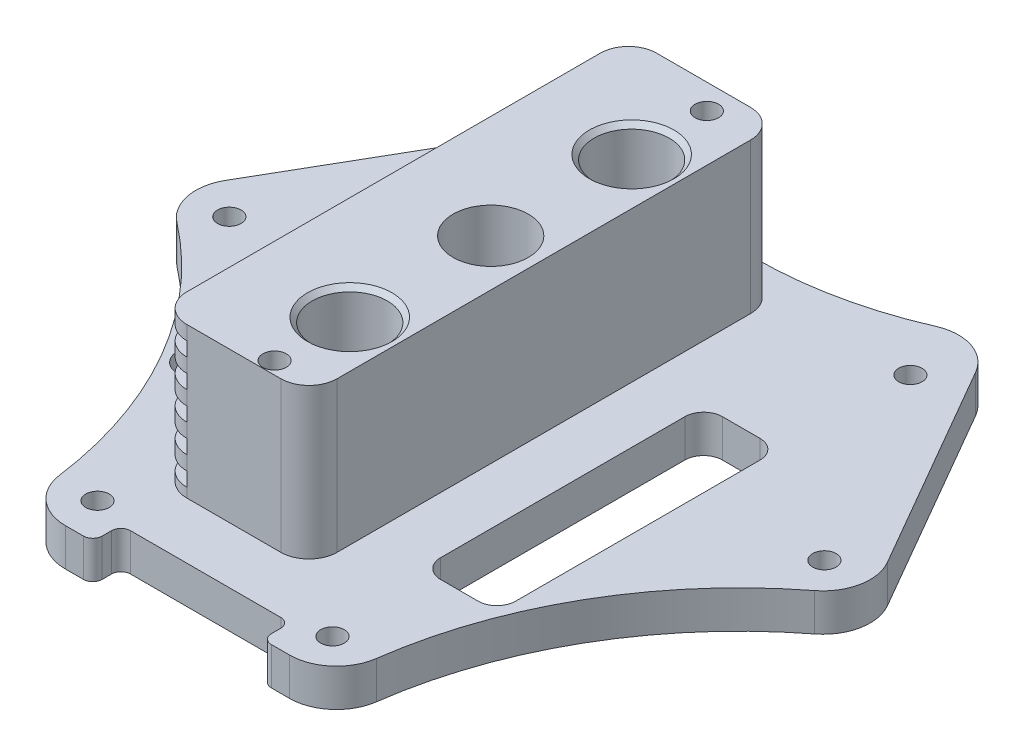
from build123d import *

# Parameters (mm, degrees)
EXTRUDE_1_DEPTH           = 4
FILLET_1_R                = 5
SKETCH_2_W                = 16
SKETCH_2_H                = 50
EXTRUDE_2_DEPTH           = 16
FILLET_2_R                = 3
SKETCH_3_W                = 6.925100322
SKETCH_3_H                = 1.5
CUT_EXTRUDE_1_DEPTH       = 70.527213361
SKETCH_4_W                = 8
SKETCH_4_H                = 30
CUT_EXTRUDE_2_DEPTH       = 52.527238457
FILLET_3_R                = 2
SKETCH_5_R                = 4
CUT_EXTRUDE_3_DEPTH       = 53.906108371
SKETCH_6_W                = 6
SKETCH_6_H                = 21
CUT_EXTRUDE_4_DEPTH       = 52.527238457
FILLET_4_R                = 2
SKETCH_7_R                = 4
CUT_EXTRUDE_5_DEPTH       = 53.906108371
CHAMFER_1_SIZE            = 0.5
M10X1_0_1_D               = 9
M10X1_0_1_DEPTH           = 4
M10X1_0_1_TIP             = 2.703872786
SKETCH_10_R               = 1
CUT_EXTRUDE_6_DEPTH       = 53.906108371
HOLE_WIZARD_M3_1_D        = 2.5
CUT_EXTRUDE_7_DEPTH       = 52.527238457
FILLET_5_R                = 3
SKETCH_17_W               = 18
SKETCH_17_H               = 3
CUT_EXTRUDE_10_DEPTH      = 4
SKETCH_18_R               = 1
CUT_EXTRUDE_11_DEPTH      = 52.527238457
HOLE_WIZARD_M3_3_D        = 2.5
PATTERN_CIRCULAR_14_COUNT = 3
FILLET_8_R                = 1


with BuildPart() as part:
    # 草圖1 → 填料-伸長1 (new body)
    with BuildSketch(Plane(origin=(0, 0, 0), x_dir=(1, 0, 0), z_dir=(0, 1, 0))):
        with BuildLine():
            Line((20, 33.341978046), (37.5, 3.031088913))
            ThreePointArc((37.5, 3.031088913), (22.496232709, -12.555193308), (16.5, -33.341978046))
            Line((16.5, -33.341978046), (-16.5, -33.341978046))
            ThreePointArc((-16.5, -33.341978046), (-22.496232709, -12.555193308), (-37.5, 3.031088913))
            Line((-37.5, 3.031088913), (-20, 33.341978046))
            ThreePointArc((-20, 33.341978046), (0, 27.982994197), (20, 33.341978046))
        make_face()
    extrude(amount=EXTRUDE_1_DEPTH)

    # 圓角1
    fillet_1_edges = [part.edges().sort_by_distance(p)[0] for p in [
        (20, 2, -33.341978046),
        (37.5, 2, -3.031088913),
        (16.5, 2, 33.341978046),
        (-16.5, 2, 33.341978046),
        (-37.5, 2, -3.031088913),
        (-20, 2, -33.341978046),
    ]]
    fillet(fillet_1_edges, radius=FILLET_1_R)

    # 草圖2 → 填料-伸長2 (add)
    with BuildSketch(Plane(origin=(0, 4, 0), x_dir=(1, 0, 0), z_dir=(0, 1, 0))):
        with Locations((-3, 0.658021954)):
            Rectangle(SKETCH_2_W, SKETCH_2_H)
    extrude(amount=EXTRUDE_2_DEPTH)

    # 圓角2
    fillet_2_edges = [part.edges().sort_by_distance(p)[0] for p in [
        (-11, 12, -25.658021954),
        (-11, 12, 24.341978046),
        (5, 12, 24.341978046),
        (5, 12, -25.658021954),
    ]]
    fillet(fillet_2_edges, radius=FILLET_2_R)

    # 草圖3 → 除料-伸長1 (cut, through all)
    with BuildSketch(Plane.XY.offset(24.341978046)):
        with Locations((-11.462550161, 17.75)):
            Rectangle(SKETCH_3_W, SKETCH_3_H)
        with Locations((-11.462550161, 14.75)):
            Rectangle(SKETCH_3_W, SKETCH_3_H)
        with Locations((-11.462550161, 11.75)):
            Rectangle(SKETCH_3_W, SKETCH_3_H)
        with Locations((-11.462550161, 8.75)):
            Rectangle(SKETCH_3_W, SKETCH_3_H)
        with Locations((-11.462550161, 5.75)):
            Rectangle(SKETCH_3_W, SKETCH_3_H)
    extrude(amount=-CUT_EXTRUDE_1_DEPTH, mode=Mode.SUBTRACT)

    # 草圖4 → 除料-伸長2 (cut, through all)
    with BuildSketch(Plane(origin=(0, 4, 0), x_dir=(1, 0, 0), z_dir=(0, 1, 0))):
        with Locations((15, -3.341978046)):
            Rectangle(SKETCH_4_W, SKETCH_4_H)
    extrude(amount=-CUT_EXTRUDE_2_DEPTH, mode=Mode.SUBTRACT)

    # 圓角3
    fillet_3_edges = [part.edges().sort_by_distance(p)[0] for p in [
        (11, 2, 18.341978046),
        (11, 2, -11.658021954),
        (19, 2, -11.658021954),
        (19, 2, 18.341978046),
    ]]
    fillet(fillet_3_edges, radius=FILLET_3_R)

    # 草圖5 → 除料-伸長3 (cut, through all)
    with BuildSketch(Plane(origin=(0, 20, 0), x_dir=(1, 0, 0), z_dir=(0, 1, 0))):
        with Locations(Location((0, 0, 0), (0, 0, 270))):
            Circle(SKETCH_5_R)
    extrude(amount=-CUT_EXTRUDE_3_DEPTH, mode=Mode.SUBTRACT)

    # 草圖6 → 除料-伸長4 (cut, through all)
    with BuildSketch(Plane(origin=(0, 4, 0), x_dir=(1, 0, 0), z_dir=(0, 1, 0))):
        with Locations((-19, -2.841978046)):
            Rectangle(SKETCH_6_W, SKETCH_6_H)
    extrude(amount=-CUT_EXTRUDE_4_DEPTH, mode=Mode.SUBTRACT)

    # 圓角4
    fillet_4_edges = [part.edges().sort_by_distance(p)[0] for p in [
        (-22, 2, 13.341978046),
        (-22, 2, -7.658021954),
        (-16, 2, -7.658021954),
        (-16, 2, 13.341978046),
    ]]
    fillet(fillet_4_edges, radius=FILLET_4_R)

    # 草圖7 → 除料-伸長5 (cut, through all)
    with BuildSketch(Plane.XZ):
        with Locations(Location((0, 15, 0), (0, 0, 270))):
            Circle(SKETCH_7_R)
        with Locations(Location((0, -15, 0), (0, 0, 270))):
            Circle(SKETCH_7_R)
    extrude(amount=-CUT_EXTRUDE_5_DEPTH, mode=Mode.SUBTRACT)

    # 導角1
    chamfer_1_edges = [part.edges().sort_by_distance(p)[0] for p in [
        (0, 20, 19),
        (0, 20, -11),
    ]]
    chamfer(chamfer_1_edges, length=CHAMFER_1_SIZE)

    # M10x1.0 螺紋孔1
    with Locations(Plane(origin=(0, 0, 0), x_dir=(-1, 0, 0), z_dir=(0, -1, 0))):
        with Locations((0, 15), (0, -15)):
            Hole(M10X1_0_1_D / 2, depth=M10X1_0_1_DEPTH)
            with Locations((0, 0, -(M10X1_0_1_DEPTH + M10X1_0_1_TIP / 2))):  # 118° drill point
                Cone(0, M10X1_0_1_D / 2, M10X1_0_1_TIP, mode=Mode.SUBTRACT)

    # 草圖10 → 除料-伸長6 (cut, through all)
    with BuildSketch(Plane.XZ):
        with Locations(Location((0, 23, 0), (0, 0, 270))):
            Circle(SKETCH_10_R)
        with Locations(Location((0, -23, 0), (0, 0, 270))):
            Circle(SKETCH_10_R)
    extrude(amount=-CUT_EXTRUDE_6_DEPTH, mode=Mode.SUBTRACT)

    # M3 螺紋孔1 (through all)
    with Locations(Plane(origin=(0, 20, 23), x_dir=(0, 0, 1), z_dir=(0, 1, 0))):
        with Locations((0, 0), (-46, 0)):
            Hole(HOLE_WIZARD_M3_1_D / 2)

    # 草圖12 → 除料-伸長7 (cut, through all)
    with BuildSketch(Plane(origin=(0, 4, 0), x_dir=(1, 0, 0), z_dir=(0, 1, 0))):
        Polygon((-16.932476545, 22.655084524), (-22.932476545, 12.262779678), (-17.736324122, 9.262779678), (-11.736324122, 19.655084524), align=None)
    extrude(amount=-CUT_EXTRUDE_7_DEPTH, mode=Mode.SUBTRACT)

    # 圓角5
    fillet_5_edges = [part.edges().sort_by_distance(p)[0] for p in [
        (-11.736324122, 2, -19.655084524),
        (-17.736324122, 2, -9.262779678),
        (-22.932476545, 2, -12.262779678),
        (-16.932476545, 2, -22.655084524),
    ]]
    fillet(fillet_5_edges, radius=FILLET_5_R - 0.0001)  # a hair under: the kernel refuses the full size

    # 草圖17 → 除料-伸長10 (cut)
    with BuildSketch(Plane.XZ):
        with Locations((0, 31.841978046)):
            Rectangle(SKETCH_17_W, SKETCH_17_H)
    extrude(amount=-CUT_EXTRUDE_10_DEPTH, mode=Mode.SUBTRACT)

    # 草圖18 → 除料-伸長11 (cut, through all)
    with BuildSketch(Plane(origin=(0, 4, 0), x_dir=(1, 0, 0), z_dir=(0, 1, 0))):
        with Locations(Location((-12.5, -29.341978046, 0), (0, 0, 270))):
            Circle(SKETCH_18_R)
        with Locations(Location((12.5, -29.341978046, 0), (0, 0, 270))):
            Circle(SKETCH_18_R)
    cut_extrude_11 = extrude(amount=-CUT_EXTRUDE_11_DEPTH, mode=Mode.SUBTRACT)

    # M3 螺紋孔3 (through all)
    with Locations(Plane(origin=(-12.5, 4, 29.341978046), x_dir=(0, 0, 1), z_dir=(0, 1, 0))):
        with Locations((0, 0), (0, 25)):
            hole_wizard_m3_3 = Hole(HOLE_WIZARD_M3_3_D / 2)

    # 環狀複製排列14: 除料-伸長11, M3 螺紋孔3 ×3 about axis
    pattern_circular_14_axis = Axis((0, 0, 0), (0, 1, 0))
    add([cut_extrude_11.rotate(pattern_circular_14_axis, i * 360 / PATTERN_CIRCULAR_14_COUNT) for i in range(1, PATTERN_CIRCULAR_14_COUNT)], mode=Mode.SUBTRACT)
    add([hole_wizard_m3_3.rotate(pattern_circular_14_axis, i * 360 / PATTERN_CIRCULAR_14_COUNT) for i in range(1, PATTERN_CIRCULAR_14_COUNT)], mode=Mode.SUBTRACT)

    # 圓角8
    fillet_8_edges = [part.edges().sort_by_distance(p)[0] for p in [
        (-9, 2, 30.341978046),
        (-9, 2, 33.341978046),
        (9, 2, 33.341978046),
        (9, 2, 30.341978046),
    ]]
    fillet(fillet_8_edges, radius=FILLET_8_R)


solid = part.part
